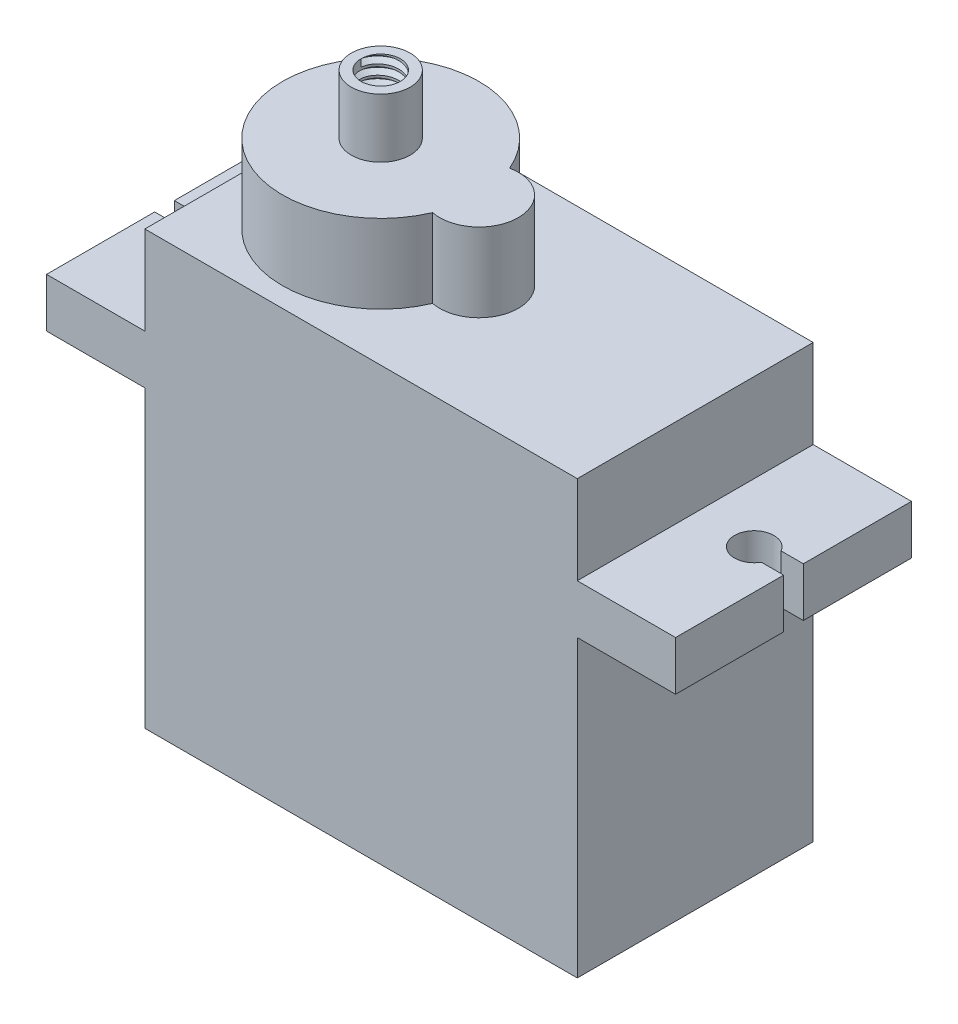
from build123d import *
from build123d.topology import SkipClean

# Parameters (mm, degrees)
SKETCH1_W             = 22
SKETCH1_H             = 12
BODY_DEPTH            = 22
HUB_DEPTH             = 4
SKETCH3_R             = 1.5
AXLE_DEPTH            = 3
SKETCH4_W             = 32
SKETCH4_H             = 12
FIN_DEPTH             = 2.5
SKETCH5_W             = 4
SKETCH5_H             = 1
WIRE_OUT_DEPTH        = 0.5
HOLE_FOR_SCREWS_REACH = 24.738
SKETCH6_R             = 1
SKETCH7_R             = 1
CUT_EXTRUDE1_DEPTH    = 6
CUT_EXTRUDE2_REACH    = 24.738
SKETCH8_W             = 2
SKETCH8_H             = 1
THREAD1_PITCH         = 0.5


with BuildPart() as part:
    # Sketch1 → Body (new body)
    with BuildSketch(Plane(origin=(0, 0, 0), x_dir=(1, 0, 0), z_dir=(0, 1, 0))):
        Rectangle(SKETCH1_W, SKETCH1_H)
    extrude(amount=BODY_DEPTH)

    # Sketch2 → Hub (add)
    with BuildSketch(Plane(origin=(0, 22, 0), x_dir=(1, 0, 0), z_dir=(0, 1, 0))):
        with BuildLine():
            ThreePointArc((-0.4, 1.959591794), (-10, 0), (-0.4, -1.959591794))
            ThreePointArc((-0.4, -1.959591794), (2, 0), (-0.4, 1.959591794))
        make_face()
    extrude(amount=HUB_DEPTH)

    # Sketch3 → Axle (add)
    with BuildSketch(Plane(origin=(0, 26, 0), x_dir=(1, 0, 0), z_dir=(0, 1, 0))):
        with Locations(Location((-5, 0, 0), (0, 0, 270))):
            Circle(SKETCH3_R)
    extrude(amount=AXLE_DEPTH)

    # Sketch4 → Fin (add)
    with BuildSketch(Plane(origin=(0, 15, 0), x_dir=(1, 0, 0), z_dir=(0, 1, 0))):
        Rectangle(SKETCH4_W, SKETCH4_H)
    extrude(amount=FIN_DEPTH)

    # Sketch5 → Wire out (add)
    with BuildSketch(Plane.ZY.offset(11)):
        with Locations((0, 4)):
            Rectangle(SKETCH5_W, SKETCH5_H)
    extrude(amount=WIRE_OUT_DEPTH)

    # Sketch6 → Hole for screws (cut, up to next)
    with BuildSketch(Plane(origin=(0, 15, 0), x_dir=(1, 0, 0), z_dir=(0, 1, 0)), mode=Mode.PRIVATE) as hole_for_screws_sk1:
        with Locations(Location((-14, 0, 0), (0, 0, 90))):
            Circle(SKETCH6_R)
    hole_for_screws_tool1 = extrude(hole_for_screws_sk1.sketch, amount=HOLE_FOR_SCREWS_REACH, mode=Mode.PRIVATE) & part.part
    # Sketch6 → Hole for screws (cut, up to next)
    with BuildSketch(Plane(origin=(0, 15, 0), x_dir=(1, 0, 0), z_dir=(0, 1, 0)), mode=Mode.PRIVATE) as hole_for_screws_sk2:
        with Locations(Location((14, 0, 0), (0, 0, 90))):
            Circle(SKETCH6_R)
    hole_for_screws_tool2 = extrude(hole_for_screws_sk2.sketch, amount=HOLE_FOR_SCREWS_REACH, mode=Mode.PRIVATE) & part.part
    add(hole_for_screws_tool1.solids().sort_by_distance((-14, 15, 0))[0], mode=Mode.SUBTRACT)
    add(hole_for_screws_tool2.solids().sort_by_distance((14, 15, 0))[0], mode=Mode.SUBTRACT)

    # Sketch7 → Cut-Extrude1 (cut)
    with BuildSketch(Plane(origin=(0, 29, 0), x_dir=(1, 0, 0), z_dir=(0, 1, 0))):
        with Locations(Location((-5, 0, 0), (0, 0, 270))):
            Circle(SKETCH7_R)
    extrude(amount=-CUT_EXTRUDE1_DEPTH, mode=Mode.SUBTRACT)

    # Sketch8 → Cut-Extrude2 (cut, up to next)
    with BuildSketch(Plane(origin=(0, 15, 0), x_dir=(1, 0, 0), z_dir=(0, 1, 0)), mode=Mode.PRIVATE) as cut_extrude2_sk1:
        with Locations((-15.5, 0)):
            Rectangle(SKETCH8_W, SKETCH8_H)
    cut_extrude2_tool1 = extrude(cut_extrude2_sk1.sketch, amount=CUT_EXTRUDE2_REACH, mode=Mode.PRIVATE) & part.part
    # Sketch8 → Cut-Extrude2 (cut, up to next)
    with BuildSketch(Plane(origin=(0, 15, 0), x_dir=(1, 0, 0), z_dir=(0, 1, 0)), mode=Mode.PRIVATE) as cut_extrude2_sk2:
        with Locations((15.5, 0)):
            Rectangle(SKETCH8_W, SKETCH8_H)
    cut_extrude2_tool2 = extrude(cut_extrude2_sk2.sketch, amount=CUT_EXTRUDE2_REACH, mode=Mode.PRIVATE) & part.part
    add(cut_extrude2_tool1.solids().sort_by_distance((-15.5, 15, 0))[0], mode=Mode.SUBTRACT)
    add(cut_extrude2_tool2.solids().sort_by_distance((15.5, 15, 0))[0], mode=Mode.SUBTRACT)

    # Thread1: the profile of Thread Profile1 profile screwed along a right-hand helix of 12 turns, 6 arcs to a turn; built about Z, then put on its axis
    with SkipClean():  # the faces are left unmerged after this step: merging them gives an invalid solid
        thread1_z = Axis((0, 0, 0), (0, 0, 1))
        thread1_corners = [(0.9997, 0, -0.000173205), (1.270632938, 0, 0.156249999), (1.270632938, 0, 0.218749999), (0.9997, 0, 0.375173204)]
        with BuildLine(mode=Mode.PRIVATE) as thread1_profile:
            Line(thread1_corners[0], thread1_corners[1])
            Line(thread1_corners[1], thread1_corners[2])
            Line(thread1_corners[2], thread1_corners[3])
            Line(thread1_corners[3], thread1_corners[0])
        thread1_cap = Face(thread1_profile.wire())
        thread1_turn_angles = [0, 30, 60, 90, 120, 150, 180, 210, 240, 270, 300, 330, 360]
        thread1_turn_weights = [1, 0.8660254037844387, 1, 0.8660254037844387, 1, 0.8660254037844387, 1, 0.8660254037844387, 1, 0.8660254037844387, 1, 0.8660254037844387, 1]
        thread1_turn_rails = [Edge.make_bspline([Vector(p[0], p[1], 0).rotate(thread1_z, thread1_turn_angles[k]) / thread1_turn_weights[k] + Vector(0, 0, p[2] + THREAD1_PITCH * thread1_turn_angles[k] / 360) for k in range(13)], [0, 0, 0, 1, 1, 2, 2, 3, 3, 4, 4, 5, 5, 6, 6, 6], 2, thread1_turn_weights) for p in thread1_corners]
        thread1_turn_sides = [Face.make_surface_from_curves(thread1_turn_rails[p[0]], thread1_turn_rails[p[1]]) for p in [(0, 1), (1, 2), (2, 3), (3, 0)]]
        thread1 = Plane(origin=(-5, 29, 0), x_dir=(-1, 0, 0), z_dir=(0, -1, 0)) * Solid(Shell([*[p.moved(Location((0, 0, THREAD1_PITCH * i))) for i in range(12) for p in thread1_turn_sides], thread1_cap, thread1_cap.rotate(thread1_z, 4320).moved(Location((0, 0, THREAD1_PITCH * 4320 / 360)))]))
        add(thread1, mode=Mode.SUBTRACT)


solid = part.part
